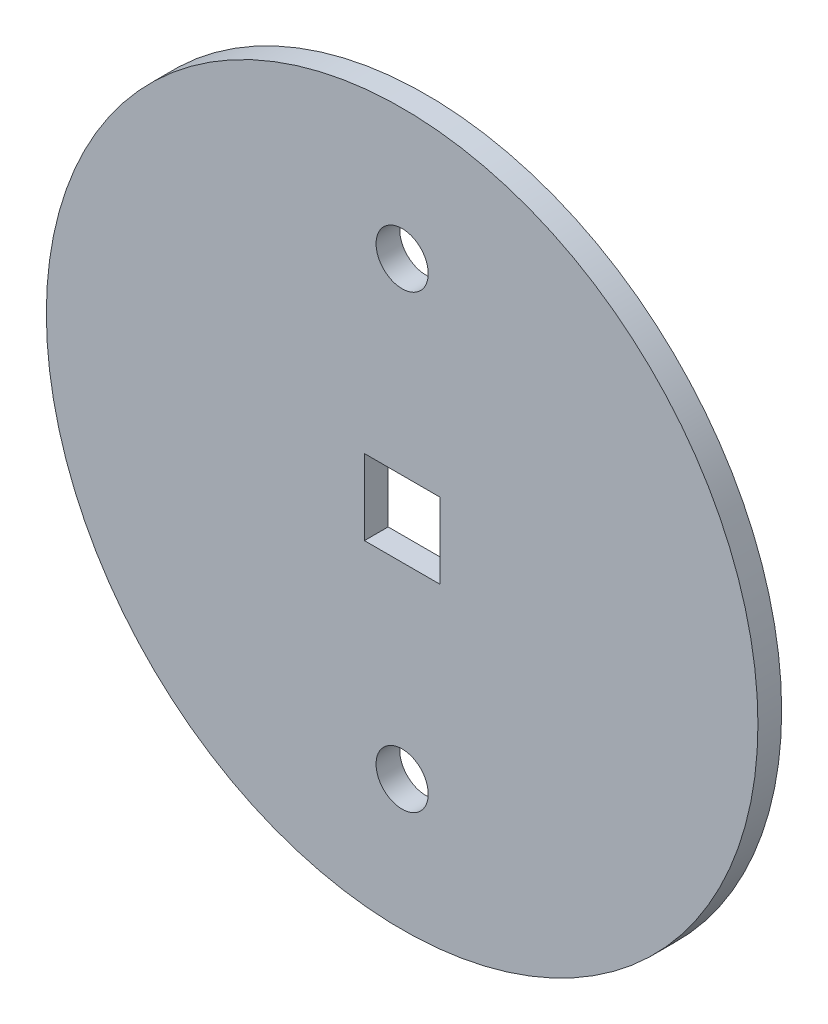
from build123d import *

# Parameters (mm, degrees)
SKETCH1_R          = 15
SKETCH1_R_2        = 1.1
BASE_FLANGE1_DEPTH = 1


# Sheet-metal steps are written as plain solids
with BuildPart() as part:
    # Sketch1 → Base-Flange1 (new body)
    with BuildSketch(Plane.XY):
        Circle(SKETCH1_R)
        with Locations((0, 9.5)):
            Circle(SKETCH1_R_2, mode=Mode.SUBTRACT)
        with Locations((0, -9.5)):
            Circle(SKETCH1_R_2, mode=Mode.SUBTRACT)
        Polygon((1.59, 0), (1.59, 1.59), (-1.59, 1.59), (-1.59, -1.59), (1.59, -1.59), align=None, mode=Mode.SUBTRACT)
    extrude(amount=-BASE_FLANGE1_DEPTH)


solid = part.part
